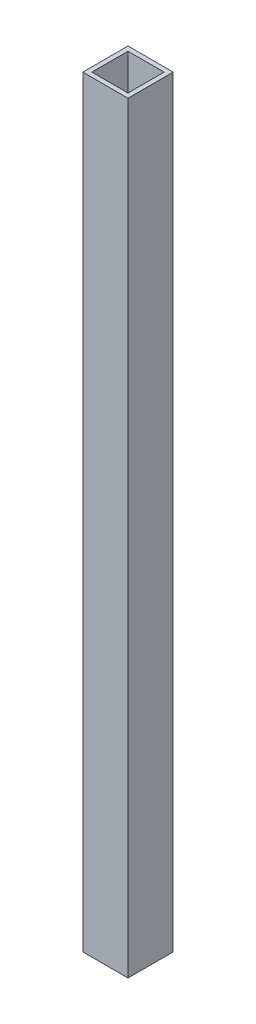
from build123d import *

# Parameters (mm, degrees)
ESBO_O1_W            = 20
ESBO_O1_H            = 20
ESBO_O1_W_2          = 16
ESBO_O1_H_2          = 16
EXTRUS_O_FINA1_DEPTH = 337


with BuildPart() as part:
    # Esboço1 → Extrusão-Fina1 (new body)
    with BuildSketch(Plane(origin=(0, 0, 0), x_dir=(1, 0, 0), z_dir=(0, 1, 0))):
        with Locations((10, 10)):
            Rectangle(ESBO_O1_W, ESBO_O1_H)
        with Locations((10, 10)):
            Rectangle(ESBO_O1_W_2, ESBO_O1_H_2, mode=Mode.SUBTRACT)
    extrude(amount=EXTRUS_O_FINA1_DEPTH)


solid = part.part
